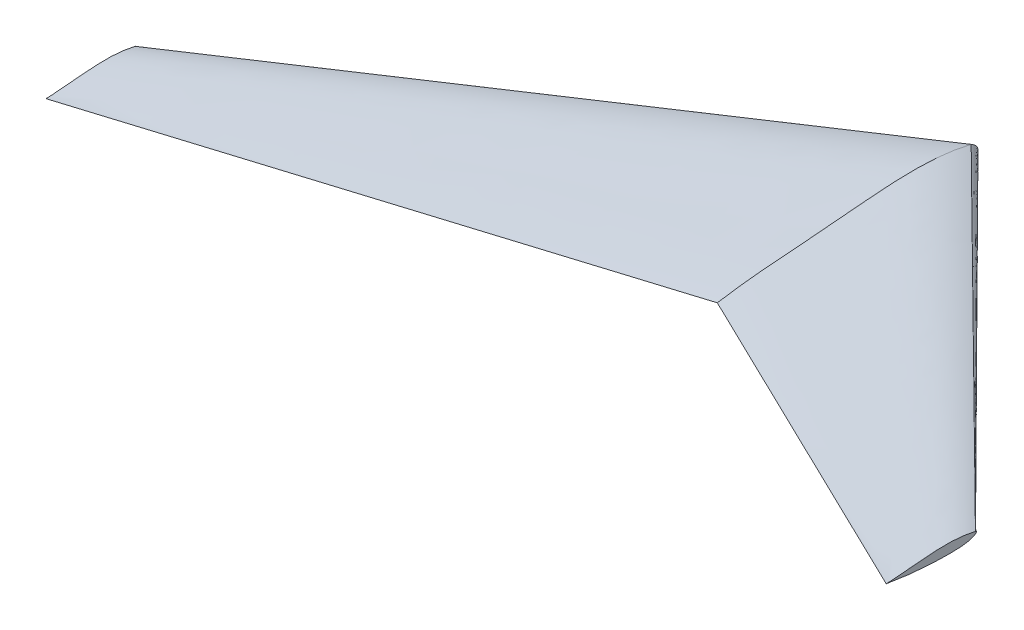
from build123d import *


with BuildPart() as part:
    # Loft1: read off the stored shape, not the designer's step
    # Loft1: loft between two sections, ruled curve by curve
    loft1_from = [
        Edge.make_bspline([(-7316.724, 1607.871034902, 43425.999695248), (-7316.724, 1555.399254926, 43124.496841722), (-7316.724, 1514.780143996, 42753.537351778), (-7316.724, 1508.498249535, 42318.483149407), (-7316.724, 1512.091435732, 42150.832822783), (-7316.724, 1527.633260124, 42017.770380841), (-7316.724, 1548.216794735, 41934.050665066), (-7316.724, 1575.378056511, 41880.420902411), (-7316.724, 1595.111481928, 41858.878595306), (-7316.724, 1608.254468516, 41855.237470627)], [0, 0, 0, 0, 0.573703222, 0.696558971, 0.815363792, 0.887382439, 0.947637453, 0.975206514, 1, 1, 1, 1], 3),
        Edge.make_bspline([(-7316.724, 1608.254468516, 41855.237470627), (-7316.724, 1612.958172417, 41857.785044707), (-7316.724, 1617.327999242, 41862.082313709), (-7316.724, 1620.34930002, 41869.143605319), (-7316.724, 1621.04781511, 41871.971655237), (-7316.724, 1621.311771552, 41873.594055468)], [0, 0, 0, 0, 0.6388622, 0.803346604, 1, 1, 1, 1], 3),
        Edge.make_bspline([(-7316.724, 1621.311771552, 41873.594055468), (-7316.724, 1685.432271103, 42131.889458428), (-7316.724, 1686.065582535, 42422.263961524), (-7316.724, 1658.895987694, 42775.193099689), (-7316.724, 1643.971199003, 42936.729530544), (-7316.724, 1630.103974345, 43112.001716618), (-7316.724, 1616.088727587, 43276.868916799), (-7316.724, 1606.756535317, 43371.118160346), (-7316.724, 1607.871034902, 43425.999695248)], [0, 0, 0, 0, 0.505310514, 0.556202967, 0.681423174, 0.817681999, 0.894695452, 1, 1, 1, 1], 3),
    ]
    loft1_to = [
        Edge.make_bspline([(0, 0, 39051.830867838), (0, -125.815178037, 38557.63147169), (0, -183.132872432, 37942.935132973), (0, -236.206325416, 37221.511433591), (0, -258.229151171, 36944.262288796), (0, -278.995937285, 36722.858257419), (0, -294.170177112, 36582.222753078), (0, -305.997548202, 36483.320057932), (0, -311.840015755, 36437.389317032), (0, -314.689043667, 36415.654477111)], [0, 0, 0, 0, 0.573703222, 0.696558971, 0.815363792, 0.887382439, 0.947637453, 0.975206514, 1, 1, 1, 1], 3),
        Edge.make_bspline([(0, -314.689043667, 36415.654477111), (0, -355.496530662, 35966.329559362), (0, -490.286226797, 35302.377879459), (0, -191.536723392, 34639.979613651), (0, 59.404043635, 34412.423088272), (0, 179.28153527, 34630.327842035)], [0, 0, 0, 0, 0.6388622, 0.803346604, 1, 1, 1, 1], 3),
        Edge.make_bspline([(0, 179.28153527, 34630.327842035), (0, 360.784253311, 35373.708232123), (0, 271.040560055, 36194.148807213), (0, 179.846888845, 37200.821655985), (0, 146.746690143, 37662.491155011), (0, 110.144400162, 38162.01450621), (0, 62.821276041, 38630.673785586), (0, 26.036215336, 38897.913216121), (0, 0, 39051.830867838)], [0, 0, 0, 0, 0.505310514, 0.556202967, 0.681423174, 0.817681999, 0.894695452, 1, 1, 1, 1], 3),
    ]
    loft1 = Solid(Shell([*[Face.make_surface_from_curves(loft1_from[k], loft1_to[k]) for k in range(3)], Face(Wire(loft1_from)), Face(Wire(loft1_to))]))
    add(loft1)

    # Mirror1: part across plane


with BuildPart() as part_1:
    add(part.part)
    add(part.part.mirror(Plane(origin=(0, 0, 0), x_dir=(0, 0, 1), z_dir=(1, 0, 0))))


solid = part_1.part
